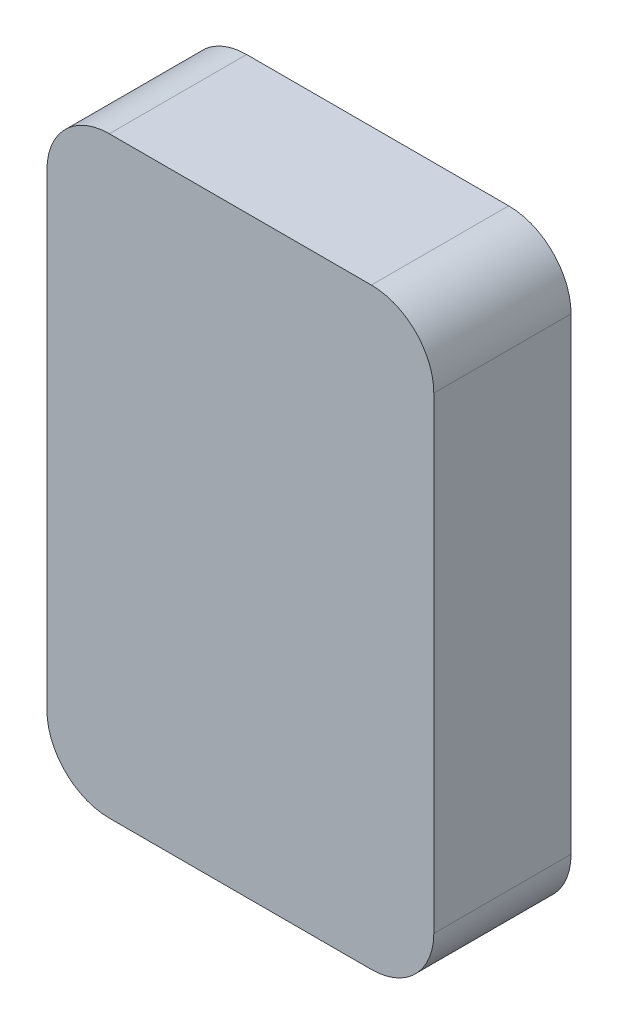
from build123d import *

# Parameters (mm, degrees)
IZIM1_W                     = 62
IZIM1_H                     = 95
Y_KSEKLIK_EKSTR_ZYON1_DEPTH = 22
RADYUS1_R                   = 10


with BuildPart() as part:
    # Çizim1 → Yükseklik-Ekstrüzyon1 (new body)
    with BuildSketch(Plane.XY):
        Rectangle(IZIM1_W, IZIM1_H)
    extrude(amount=Y_KSEKLIK_EKSTR_ZYON1_DEPTH)

    # Radyus1
    radyus1_edges = [part.edges().sort_by_distance(p)[0] for p in [
        (-31, -47.5, 11),
        (31, -47.5, 11),
        (31, 47.5, 11),
        (-31, 47.5, 11),
    ]]
    fillet(radyus1_edges, radius=RADYUS1_R)


solid = part.part
